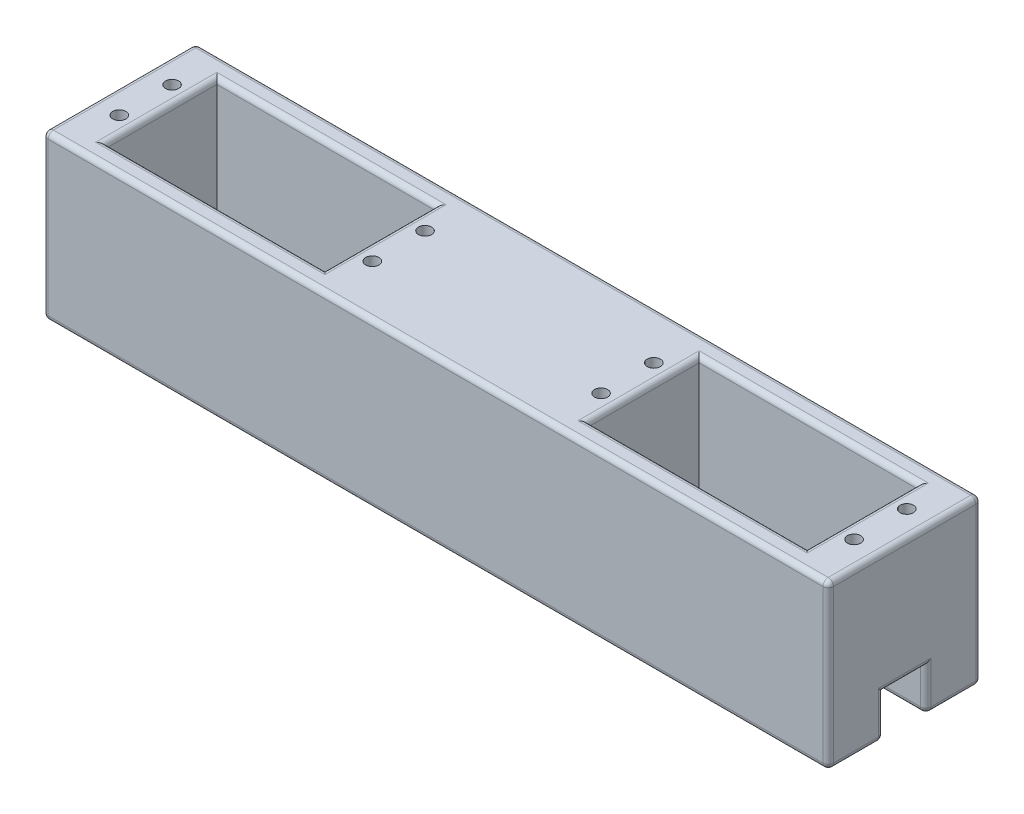
from build123d import *

# Parameters (mm, degrees)
SKETCH_1_W          = 149
SKETCH_1_H          = 29
SKETCH_1_W_2        = 41.5
SKETCH_1_H_2        = 21
EXTRUDE_1_DEPTH     = 28
SKETCH_2_W          = 149
SKETCH_2_H          = 29
EXTRUDE_2_DEPTH     = 3
SKETCH_3_W          = 8
SKETCH_3_H          = 8
CUT_EXTRUDE_1_DEPTH = 8
SKETCH_4_R          = 5.5
EXTRUDE_3_DEPTH     = 8
FILLET_1_R          = 1
FILLET_5_R          = 1
FILLET_6_R          = 1
SKETCH_5_R          = 1.25
CUT_EXTRUDE_2_DEPTH = 8


with BuildPart() as part:
    # 草图1 → 凸台-拉伸1 (new body)
    with BuildSketch(Plane(origin=(0, 0, 0), x_dir=(1, 0, 0), z_dir=(0, 1, 0))):
        Rectangle(SKETCH_1_W, SKETCH_1_H)
        with Locations((-45.75, 0)):
            Rectangle(SKETCH_1_W_2, SKETCH_1_H_2, mode=Mode.SUBTRACT)
        with Locations((45.75, 0)):
            Rectangle(SKETCH_1_W_2, SKETCH_1_H_2, mode=Mode.SUBTRACT)
    extrude(amount=EXTRUDE_1_DEPTH)

    # 草图2 → 凸台-拉伸2 (add)
    with BuildSketch(Plane.XZ):
        Rectangle(SKETCH_2_W, SKETCH_2_H)
    extrude(amount=EXTRUDE_2_DEPTH)

    # 草图3 → 切除-拉伸1 (cut)
    with BuildSketch(Plane(origin=(74.5, 0, 0), x_dir=(0, 0, -1), z_dir=(1, 0, 0))):
        with Locations((0, 1)):
            Rectangle(SKETCH_3_W, SKETCH_3_H)
    cut_extrude_1 = extrude(amount=-CUT_EXTRUDE_1_DEPTH, mode=Mode.SUBTRACT)

    # 镜向1: 切除-拉伸1 across plane
    add(cut_extrude_1.mirror(Plane(origin=(0, 0, 0), x_dir=(0, 0, 1), z_dir=(1, 0, 0))), mode=Mode.SUBTRACT)

    # 草图4 → 凸台-拉伸3 (add)
    with BuildSketch(Plane(origin=(0, -3, 0), x_dir=(-1, 0, 0), z_dir=(0, -1, 0))):
        with Locations(Location((-56.2, 0, 0), (0, 0, 90))):
            Circle(SKETCH_4_R)
        with Locations(Location((56.2, 0, 0), (0, 0, 270))):
            Circle(SKETCH_4_R)
    extrude(amount=EXTRUDE_3_DEPTH)

    # 圆角1
    fillet_1_edges = [part.edges().sort_by_distance(p)[0] for p in [
        (-56.2, -11, -5.5),
        (56.2, -11, 5.5),
    ]]
    fillet(fillet_1_edges, radius=FILLET_1_R)

    # 圆角5
    fillet_5_edges = [part.edges().sort_by_distance(p)[0] for p in [
        (74.5, 28, 0),
        (0, 28, -14.5),
        (-66.5, 28, 0),
        (-45.75, 28, 10.5),
        (-25, 28, 0),
        (-45.75, 28, -10.5),
        (25, 28, 0),
        (45.75, 28, 10.5),
        (66.5, 28, 0),
        (45.75, 28, -10.5),
        (-74.5, 28, 0),
        (-74.5, -3, 9.25),
        (0, -3, -14.5),
        (74.5, -3, -9.25),
        (0, -3, 14.5),
        (74.5, -3, 9.25),
        (74.5, 1, 4),
        (74.5, 1, -4),
        (74.5, 5, 0),
        (0, 28, 14.5),
        (-74.5, 12.5, -14.5),
        (74.5, 12.5, -14.5),
        (74.5, 12.5, 14.5),
        (-74.5, 12.5, 14.5),
        (-74.5, -3, -9.25),
        (-74.5, 1, 4),
        (-74.5, 1, -4),
        (-74.5, 5, 0),
    ]]
    fillet(fillet_5_edges, radius=FILLET_5_R)

    # 圆角6
    # the kernel refuses this fillet: 1 mm, written as the material it takes off along each edge
    with BuildSketch(Plane(origin=(-73.5, -2, 5), x_dir=(0, 0, -1), z_dir=(0, -1, 0))) as fillet_6_piece_1_section:
        Polygon((0, 0), (FILLET_6_R * 1.02, 0), (FILLET_6_R * 1.02, -FILLET_6_R * 1.02), (0, -FILLET_6_R * 1.02), align=None)
    fillet_6_piece_1 = extrude(amount=FILLET_6_R * 1.02, mode=Mode.PRIVATE)
    fillet_6_piece_1 = fillet_6_piece_1 - Plane(origin=(-73.5, -2, 5), x_dir=(0.7071067811865475, 0, 0.7071067811865475), z_dir=(0, -1, 0)) * Sphere(FILLET_6_R, mode=Mode.PRIVATE)
    add(fillet_6_piece_1, mode=Mode.SUBTRACT)
    with BuildSketch(Plane(origin=(-73.5, -2, -5), x_dir=(0, 0, 1), z_dir=(0, -1, 0))) as fillet_6_piece_2_section:
        Polygon((0, 0), (FILLET_6_R * 1.02, 0), (FILLET_6_R * 1.02, FILLET_6_R * 1.02), (0, FILLET_6_R * 1.02), align=None)
    fillet_6_piece_2 = extrude(amount=FILLET_6_R * 1.02, mode=Mode.PRIVATE)
    fillet_6_piece_2 = fillet_6_piece_2 - Plane(origin=(-73.5, -2, -5), x_dir=(0.7071067811865475, 0, -0.7071067811865475), z_dir=(0, -1, 0)) * Sphere(FILLET_6_R, mode=Mode.PRIVATE)
    add(fillet_6_piece_2, mode=Mode.SUBTRACT)
    with BuildSketch(Plane(origin=(73.5, -2, 5), x_dir=(0, 0, -1), z_dir=(0, -1, 0))) as fillet_6_piece_3_section:
        Polygon((0, 0), (FILLET_6_R * 1.02, 0), (FILLET_6_R * 1.02, FILLET_6_R * 1.02), (0, FILLET_6_R * 1.02), align=None)
    fillet_6_piece_3 = extrude(amount=FILLET_6_R * 1.02, mode=Mode.PRIVATE)
    fillet_6_piece_3 = fillet_6_piece_3 - Plane(origin=(73.5, -2, 5), x_dir=(-0.7071067811865475, 0, 0.7071067811865475), z_dir=(0, -1, 0)) * Sphere(FILLET_6_R, mode=Mode.PRIVATE)
    add(fillet_6_piece_3, mode=Mode.SUBTRACT)
    with BuildSketch(Plane(origin=(73.5, -2, -5), x_dir=(0, 0, 1), z_dir=(0, -1, 0))) as fillet_6_piece_4_section:
        Polygon((0, 0), (FILLET_6_R * 1.02, 0), (FILLET_6_R * 1.02, -FILLET_6_R * 1.02), (0, -FILLET_6_R * 1.02), align=None)
    fillet_6_piece_4 = extrude(amount=FILLET_6_R * 1.02, mode=Mode.PRIVATE)
    fillet_6_piece_4 = fillet_6_piece_4 - Plane(origin=(73.5, -2, -5), x_dir=(-0.7071067811865475, 0, -0.7071067811865475), z_dir=(0, -1, 0)) * Sphere(FILLET_6_R, mode=Mode.PRIVATE)
    add(fillet_6_piece_4, mode=Mode.SUBTRACT)
    with BuildSketch(Plane(origin=(66.5, 0, 4), x_dir=(0, -1, 0), z_dir=(0, 0, -1))) as fillet_6_piece_5_section:
        with BuildLine():
            CenterArc((FILLET_6_R, FILLET_6_R), FILLET_6_R, 180, 90)
            Line((0, FILLET_6_R), (-FILLET_6_R * 0.02, FILLET_6_R))
            Line((-FILLET_6_R * 0.02, FILLET_6_R), (-FILLET_6_R * 0.02, -FILLET_6_R * 0.02))
            Line((-FILLET_6_R * 0.02, -FILLET_6_R * 0.02), (FILLET_6_R, -FILLET_6_R * 0.02))
            Line((FILLET_6_R, -FILLET_6_R * 0.02), (FILLET_6_R, 0))
        make_face()
    fillet_6_piece_5 = extrude(amount=8, mode=Mode.PRIVATE)
    fillet_6_piece_5 = split(fillet_6_piece_5, bisect_by=Plane(origin=(66.5, -0.20347313, 0), z_dir=(-1, 0, 0)), keep=Keep.TOP, mode=Mode.PRIVATE)
    add(fillet_6_piece_5, mode=Mode.SUBTRACT)
    with BuildSketch(Plane(origin=(73.5, -3, 4), x_dir=(0, 0, 1), z_dir=(-1, 0, 0)), Plane(origin=(-73.5, -3, -4), x_dir=(0, 0, -1), z_dir=(1, 0, 0))) as fillet_6_piece_6:
        with BuildLine():
            CenterArc((FILLET_6_R, FILLET_6_R), FILLET_6_R, 180, 90)
            Line((0, FILLET_6_R), (-FILLET_6_R * 0.02, FILLET_6_R))
            Line((-FILLET_6_R * 0.02, FILLET_6_R), (-FILLET_6_R * 0.02, -FILLET_6_R * 0.02))
            Line((-FILLET_6_R * 0.02, -FILLET_6_R * 0.02), (FILLET_6_R, -FILLET_6_R * 0.02))
            Line((FILLET_6_R, -FILLET_6_R * 0.02), (FILLET_6_R, 0))
        make_face()
    extrude(amount=7, mode=Mode.SUBTRACT)
    with BuildSketch(Plane(origin=(66.5, -3, 4), x_dir=(-1, 0, 0), z_dir=(0, 0, -1))) as fillet_6_piece_7:
        with BuildLine():
            CenterArc((FILLET_6_R, FILLET_6_R), FILLET_6_R, 180, 90)
            Line((0, FILLET_6_R), (-FILLET_6_R * 0.02, FILLET_6_R))
            Line((-FILLET_6_R * 0.02, FILLET_6_R), (-FILLET_6_R * 0.02, -FILLET_6_R * 0.02))
            Line((-FILLET_6_R * 0.02, -FILLET_6_R * 0.02), (FILLET_6_R, -FILLET_6_R * 0.02))
            Line((FILLET_6_R, -FILLET_6_R * 0.02), (FILLET_6_R, 0))
        make_face()
    extrude(amount=8, mode=Mode.SUBTRACT)
    with BuildSketch(Plane(origin=(73.5, -3, -4), x_dir=(0, 0, -1), z_dir=(-1, 0, 0)), Plane(origin=(-73.5, -3, 4), x_dir=(0, 0, 1), z_dir=(1, 0, 0))) as fillet_6_piece_8:
        with BuildLine():
            CenterArc((FILLET_6_R, -FILLET_6_R), FILLET_6_R, 90, 90)
            Line((0, -FILLET_6_R), (-FILLET_6_R * 0.02, -FILLET_6_R))
            Line((-FILLET_6_R * 0.02, -FILLET_6_R), (-FILLET_6_R * 0.02, FILLET_6_R * 0.02))
            Line((-FILLET_6_R * 0.02, FILLET_6_R * 0.02), (FILLET_6_R, FILLET_6_R * 0.02))
            Line((FILLET_6_R, FILLET_6_R * 0.02), (FILLET_6_R, 0))
        make_face()
    extrude(amount=7, mode=Mode.SUBTRACT)
    with BuildSketch(Plane(origin=(-66.5, 0, -4), x_dir=(0, -1, 0), z_dir=(0, 0, 1))) as fillet_6_piece_9_section:
        with BuildLine():
            CenterArc((FILLET_6_R, FILLET_6_R), FILLET_6_R, 180, 90)
            Line((0, FILLET_6_R), (-FILLET_6_R * 0.02, FILLET_6_R))
            Line((-FILLET_6_R * 0.02, FILLET_6_R), (-FILLET_6_R * 0.02, -FILLET_6_R * 0.02))
            Line((-FILLET_6_R * 0.02, -FILLET_6_R * 0.02), (FILLET_6_R, -FILLET_6_R * 0.02))
            Line((FILLET_6_R, -FILLET_6_R * 0.02), (FILLET_6_R, 0))
        make_face()
    fillet_6_piece_9 = extrude(amount=8, mode=Mode.PRIVATE)
    fillet_6_piece_9 = split(fillet_6_piece_9, bisect_by=Plane(origin=(-66.5, -0.20347313, 0), z_dir=(1, 0, 0)), keep=Keep.TOP, mode=Mode.PRIVATE)
    add(fillet_6_piece_9, mode=Mode.SUBTRACT)
    with BuildSketch(Plane(origin=(-66.5, -3, 4), x_dir=(1, 0, 0), z_dir=(0, 0, -1))) as fillet_6_piece_10:
        with BuildLine():
            CenterArc((FILLET_6_R, -FILLET_6_R), FILLET_6_R, 90, 90)
            Line((0, -FILLET_6_R), (-FILLET_6_R * 0.02, -FILLET_6_R))
            Line((-FILLET_6_R * 0.02, -FILLET_6_R), (-FILLET_6_R * 0.02, FILLET_6_R * 0.02))
            Line((-FILLET_6_R * 0.02, FILLET_6_R * 0.02), (FILLET_6_R, FILLET_6_R * 0.02))
            Line((FILLET_6_R, FILLET_6_R * 0.02), (FILLET_6_R, 0))
        make_face()
    extrude(amount=8, mode=Mode.SUBTRACT)
    with BuildSketch(Plane(origin=(66.5, -3, 6.5), x_dir=(-1, 0, 0), z_dir=(0, 0, -1))) as fillet_6_piece_11a_section:
        with BuildLine():
            CenterArc((FILLET_6_R, FILLET_6_R), FILLET_6_R, 180, 90)
            Line((0, FILLET_6_R), (-FILLET_6_R * 0.02, FILLET_6_R))
            Line((-FILLET_6_R * 0.02, FILLET_6_R), (-FILLET_6_R * 0.02, -FILLET_6_R * 0.02))
            Line((-FILLET_6_R * 0.02, -FILLET_6_R * 0.02), (FILLET_6_R, -FILLET_6_R * 0.02))
            Line((FILLET_6_R, -FILLET_6_R * 0.02), (FILLET_6_R, 0))
        make_face()
    fillet_6_piece_11a = extrude(amount=10.5, mode=Mode.PRIVATE)
    fillet_6_piece_11a = split(fillet_6_piece_11a, bisect_by=Plane(origin=(66.273604886, -2.773604886, 4), z_dir=(0, 0, 1)), keep=Keep.TOP, mode=Mode.PRIVATE)
    with BuildSketch(Plane(origin=(73.5, -3, 4), x_dir=(0, 0, 1), z_dir=(-1, 0, 0))) as fillet_6_piece_11b_section:
        with BuildLine():
            CenterArc((FILLET_6_R, FILLET_6_R), FILLET_6_R, 180, 90)
            Line((0, FILLET_6_R), (-FILLET_6_R * 0.02, FILLET_6_R))
            Line((-FILLET_6_R * 0.02, FILLET_6_R), (-FILLET_6_R * 0.02, -FILLET_6_R * 0.02))
            Line((-FILLET_6_R * 0.02, -FILLET_6_R * 0.02), (FILLET_6_R, -FILLET_6_R * 0.02))
            Line((FILLET_6_R, -FILLET_6_R * 0.02), (FILLET_6_R, 0))
        make_face()
    fillet_6_piece_11b = extrude(amount=9.5, mode=Mode.PRIVATE)
    fillet_6_piece_11b = split(fillet_6_piece_11b, bisect_by=Plane(origin=(66.5, -2.773604886, 4.226395114), z_dir=(-1, 0, 0)), keep=Keep.TOP, mode=Mode.PRIVATE)
    fillet_6_piece_11 = fillet_6_piece_11a & fillet_6_piece_11b
    add(fillet_6_piece_11, mode=Mode.SUBTRACT)
    with BuildSketch(Plane(origin=(73.5, -3, -4), x_dir=(0, 0, -1), z_dir=(-1, 0, 0))) as fillet_6_piece_12a_section:
        with BuildLine():
            CenterArc((FILLET_6_R, -FILLET_6_R), FILLET_6_R, 90, 90)
            Line((0, -FILLET_6_R), (-FILLET_6_R * 0.02, -FILLET_6_R))
            Line((-FILLET_6_R * 0.02, -FILLET_6_R), (-FILLET_6_R * 0.02, FILLET_6_R * 0.02))
            Line((-FILLET_6_R * 0.02, FILLET_6_R * 0.02), (FILLET_6_R, FILLET_6_R * 0.02))
            Line((FILLET_6_R, FILLET_6_R * 0.02), (FILLET_6_R, 0))
        make_face()
    fillet_6_piece_12a = extrude(amount=9.5, mode=Mode.PRIVATE)
    fillet_6_piece_12a = split(fillet_6_piece_12a, bisect_by=Plane(origin=(66.5, -2.773604886, -4.226395114), z_dir=(-1, 0, 0)), keep=Keep.TOP, mode=Mode.PRIVATE)
    with BuildSketch(Plane(origin=(66.5, -3, 4), x_dir=(-1, 0, 0), z_dir=(0, 0, -1))) as fillet_6_piece_12b_section:
        with BuildLine():
            CenterArc((FILLET_6_R, FILLET_6_R), FILLET_6_R, 180, 90)
            Line((0, FILLET_6_R), (-FILLET_6_R * 0.02, FILLET_6_R))
            Line((-FILLET_6_R * 0.02, FILLET_6_R), (-FILLET_6_R * 0.02, -FILLET_6_R * 0.02))
            Line((-FILLET_6_R * 0.02, -FILLET_6_R * 0.02), (FILLET_6_R, -FILLET_6_R * 0.02))
            Line((FILLET_6_R, -FILLET_6_R * 0.02), (FILLET_6_R, 0))
        make_face()
    fillet_6_piece_12b = extrude(amount=10.5, mode=Mode.PRIVATE)
    fillet_6_piece_12b = split(fillet_6_piece_12b, bisect_by=Plane(origin=(66.273604886, -2.773604886, -4), z_dir=(0, 0, -1)), keep=Keep.TOP, mode=Mode.PRIVATE)
    fillet_6_piece_12 = fillet_6_piece_12a & fillet_6_piece_12b
    add(fillet_6_piece_12, mode=Mode.SUBTRACT)
    with BuildSketch(Plane(origin=(-66.5, -3, 6.5), x_dir=(1, 0, 0), z_dir=(0, 0, -1))) as fillet_6_piece_13a_section:
        with BuildLine():
            CenterArc((FILLET_6_R, -FILLET_6_R), FILLET_6_R, 90, 90)
            Line((0, -FILLET_6_R), (-FILLET_6_R * 0.02, -FILLET_6_R))
            Line((-FILLET_6_R * 0.02, -FILLET_6_R), (-FILLET_6_R * 0.02, FILLET_6_R * 0.02))
            Line((-FILLET_6_R * 0.02, FILLET_6_R * 0.02), (FILLET_6_R, FILLET_6_R * 0.02))
            Line((FILLET_6_R, FILLET_6_R * 0.02), (FILLET_6_R, 0))
        make_face()
    fillet_6_piece_13a = extrude(amount=10.5, mode=Mode.PRIVATE)
    fillet_6_piece_13a = split(fillet_6_piece_13a, bisect_by=Plane(origin=(-66.273604886, -2.773604886, 4), z_dir=(0, 0, 1)), keep=Keep.TOP, mode=Mode.PRIVATE)
    with BuildSketch(Plane(origin=(-73.5, -3, 4), x_dir=(0, 0, 1), z_dir=(1, 0, 0))) as fillet_6_piece_13b_section:
        with BuildLine():
            CenterArc((FILLET_6_R, -FILLET_6_R), FILLET_6_R, 90, 90)
            Line((0, -FILLET_6_R), (-FILLET_6_R * 0.02, -FILLET_6_R))
            Line((-FILLET_6_R * 0.02, -FILLET_6_R), (-FILLET_6_R * 0.02, FILLET_6_R * 0.02))
            Line((-FILLET_6_R * 0.02, FILLET_6_R * 0.02), (FILLET_6_R, FILLET_6_R * 0.02))
            Line((FILLET_6_R, FILLET_6_R * 0.02), (FILLET_6_R, 0))
        make_face()
    fillet_6_piece_13b = extrude(amount=9.5, mode=Mode.PRIVATE)
    fillet_6_piece_13b = split(fillet_6_piece_13b, bisect_by=Plane(origin=(-66.5, -2.773604886, 4.226395114), z_dir=(1, 0, 0)), keep=Keep.TOP, mode=Mode.PRIVATE)
    fillet_6_piece_13 = fillet_6_piece_13a & fillet_6_piece_13b
    add(fillet_6_piece_13, mode=Mode.SUBTRACT)
    with BuildSketch(Plane(origin=(-73.5, -3, -4), x_dir=(0, 0, -1), z_dir=(1, 0, 0))) as fillet_6_piece_14a_section:
        with BuildLine():
            CenterArc((FILLET_6_R, FILLET_6_R), FILLET_6_R, 180, 90)
            Line((0, FILLET_6_R), (-FILLET_6_R * 0.02, FILLET_6_R))
            Line((-FILLET_6_R * 0.02, FILLET_6_R), (-FILLET_6_R * 0.02, -FILLET_6_R * 0.02))
            Line((-FILLET_6_R * 0.02, -FILLET_6_R * 0.02), (FILLET_6_R, -FILLET_6_R * 0.02))
            Line((FILLET_6_R, -FILLET_6_R * 0.02), (FILLET_6_R, 0))
        make_face()
    fillet_6_piece_14a = extrude(amount=9.5, mode=Mode.PRIVATE)
    fillet_6_piece_14a = split(fillet_6_piece_14a, bisect_by=Plane(origin=(-66.5, -2.773604886, -4.226395114), z_dir=(1, 0, 0)), keep=Keep.TOP, mode=Mode.PRIVATE)
    with BuildSketch(Plane(origin=(-66.5, -3, 4), x_dir=(1, 0, 0), z_dir=(0, 0, -1))) as fillet_6_piece_14b_section:
        with BuildLine():
            CenterArc((FILLET_6_R, -FILLET_6_R), FILLET_6_R, 90, 90)
            Line((0, -FILLET_6_R), (-FILLET_6_R * 0.02, -FILLET_6_R))
            Line((-FILLET_6_R * 0.02, -FILLET_6_R), (-FILLET_6_R * 0.02, FILLET_6_R * 0.02))
            Line((-FILLET_6_R * 0.02, FILLET_6_R * 0.02), (FILLET_6_R, FILLET_6_R * 0.02))
            Line((FILLET_6_R, FILLET_6_R * 0.02), (FILLET_6_R, 0))
        make_face()
    fillet_6_piece_14b = extrude(amount=10.5, mode=Mode.PRIVATE)
    fillet_6_piece_14b = split(fillet_6_piece_14b, bisect_by=Plane(origin=(-66.273604886, -2.773604886, -4), z_dir=(0, 0, -1)), keep=Keep.TOP, mode=Mode.PRIVATE)
    fillet_6_piece_14 = fillet_6_piece_14a & fillet_6_piece_14b
    add(fillet_6_piece_14, mode=Mode.SUBTRACT)

    # 草图5 → 切除-拉伸2 (cut)
    with BuildSketch(Plane(origin=(0, 28, 0), x_dir=(1, 0, 0), z_dir=(0, 1, 0))):
        with Locations(Location((-69.7, 5.2, 0), (0, 0, 270))):
            Circle(SKETCH_5_R)
        with Locations(Location((-69.7, -4.8, 0), (0, 0, 270))):
            Circle(SKETCH_5_R)
        with Locations(Location((-21.7, 5.2, 0), (0, 0, 270))):
            Circle(SKETCH_5_R)
        with Locations(Location((-21.7, -4.8, 0), (0, 0, 270))):
            Circle(SKETCH_5_R)
        with Locations(Location((21.7, -4.8, 0), (0, 0, 90))):
            Circle(SKETCH_5_R)
        with Locations(Location((21.7, 5.2, 0), (0, 0, 90))):
            Circle(SKETCH_5_R)
        with Locations(Location((69.7, -4.8, 0), (0, 0, 90))):
            Circle(SKETCH_5_R)
        with Locations(Location((69.7, 5.2, 0), (0, 0, 90))):
            Circle(SKETCH_5_R)
    extrude(amount=-CUT_EXTRUDE_2_DEPTH, mode=Mode.SUBTRACT)


solid = part.part
